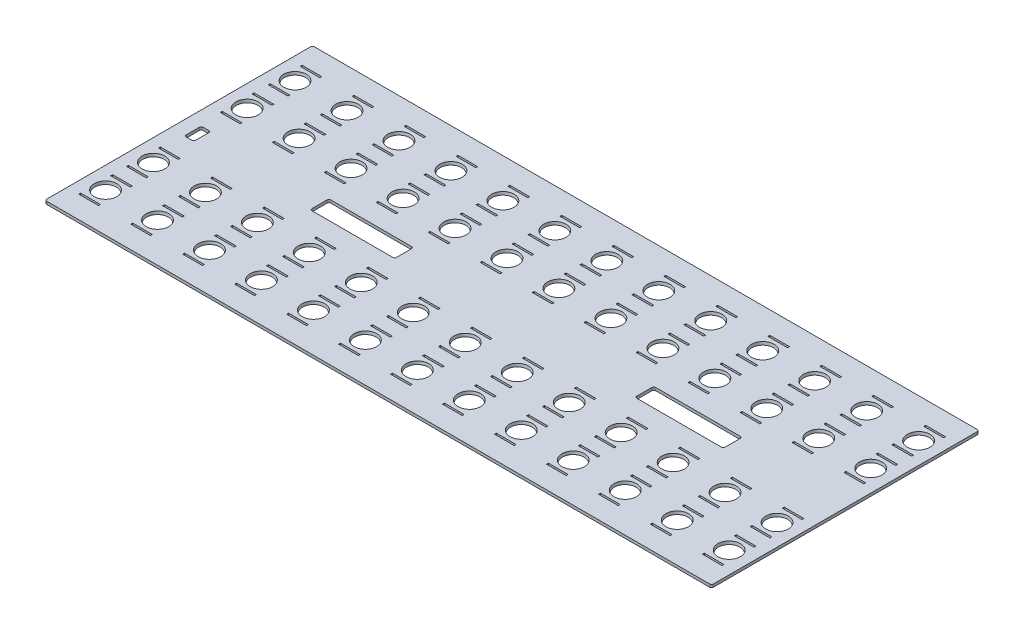
from build123d import *

# Parameters (mm, degrees)
BOSS_EXTRUDE1_DEPTH      = 3
CUT_EXTRUDE1_DEPTH       = 725.165209051
LPATTERN1_COUNT          = 13
LPATTERN1_PITCH          = 55.35
LPATTERN1_COUNT_DIR2     = 2
LPATTERN1_PITCH_DIR2     = 51
SKETCH7_W                = 21
SKETCH7_H                = 2
CUT_EXTRUDE2_DEPTH       = 725.165209051
LPATTERN2_COUNT          = 13
LPATTERN2_PITCH          = 55.35
LPATTERN2_COUNT_DIR2     = 2
LPATTERN2_PITCH_DIR2     = 51
MIRROR2_COPY_1_SKETCH_W  = 21
MIRROR2_COPY_1_SKETCH_H  = 2
MIRROR2_COPY_1_DEPTH     = 725.165209051
MIRROR2_COPY_2_SKETCH_W  = 21
MIRROR2_COPY_2_SKETCH_H  = 2
MIRROR2_COPY_2_DEPTH     = 725.165209051
MIRROR2_COPY_3_SKETCH_W  = 21
MIRROR2_COPY_3_SKETCH_H  = 2
MIRROR2_COPY_3_DEPTH     = 725.165209051
MIRROR2_COPY_4_SKETCH_W  = 21
MIRROR2_COPY_4_SKETCH_H  = 2
MIRROR2_COPY_4_DEPTH     = 725.165209051
MIRROR2_COPY_5_SKETCH_W  = 21
MIRROR2_COPY_5_SKETCH_H  = 2
MIRROR2_COPY_5_DEPTH     = 725.165209051
MIRROR2_COPY_6_SKETCH_W  = 21
MIRROR2_COPY_6_SKETCH_H  = 2
MIRROR2_COPY_6_DEPTH     = 725.165209051
MIRROR2_COPY_7_SKETCH_W  = 21
MIRROR2_COPY_7_SKETCH_H  = 2
MIRROR2_COPY_7_DEPTH     = 725.165209051
MIRROR2_COPY_8_SKETCH_W  = 21
MIRROR2_COPY_8_SKETCH_H  = 2
MIRROR2_COPY_8_DEPTH     = 725.165209051
MIRROR2_COPY_9_SKETCH_W  = 21
MIRROR2_COPY_9_SKETCH_H  = 2
MIRROR2_COPY_9_DEPTH     = 725.165209051
MIRROR2_COPY_10_SKETCH_W = 21
MIRROR2_COPY_10_SKETCH_H = 2
MIRROR2_COPY_10_DEPTH    = 725.165209051
MIRROR2_COPY_11_SKETCH_W = 21
MIRROR2_COPY_11_SKETCH_H = 2
MIRROR2_COPY_11_DEPTH    = 725.165209051
MIRROR2_COPY_12_SKETCH_W = 21
MIRROR2_COPY_12_SKETCH_H = 2
MIRROR2_COPY_12_DEPTH    = 725.165209051
MIRROR2_COPY_13_SKETCH_W = 21
MIRROR2_COPY_13_SKETCH_H = 2
MIRROR2_COPY_13_DEPTH    = 725.165209051
MIRROR2_COPY_14_SKETCH_W = 21
MIRROR2_COPY_14_SKETCH_H = 2
MIRROR2_COPY_14_DEPTH    = 725.165209051
MIRROR2_COPY_15_SKETCH_W = 21
MIRROR2_COPY_15_SKETCH_H = 2
MIRROR2_COPY_15_DEPTH    = 725.165209051
MIRROR2_COPY_16_SKETCH_W = 21
MIRROR2_COPY_16_SKETCH_H = 2
MIRROR2_COPY_16_DEPTH    = 725.165209051
MIRROR2_COPY_17_SKETCH_W = 21
MIRROR2_COPY_17_SKETCH_H = 2
MIRROR2_COPY_17_DEPTH    = 725.165209051
MIRROR2_COPY_18_SKETCH_W = 21
MIRROR2_COPY_18_SKETCH_H = 2
MIRROR2_COPY_18_DEPTH    = 725.165209051
MIRROR2_COPY_19_SKETCH_W = 21
MIRROR2_COPY_19_SKETCH_H = 2
MIRROR2_COPY_19_DEPTH    = 725.165209051
MIRROR2_COPY_20_SKETCH_W = 21
MIRROR2_COPY_20_SKETCH_H = 2
MIRROR2_COPY_20_DEPTH    = 725.165209051
MIRROR2_COPY_21_SKETCH_W = 21
MIRROR2_COPY_21_SKETCH_H = 2
MIRROR2_COPY_21_DEPTH    = 725.165209051
MIRROR2_COPY_22_SKETCH_W = 21
MIRROR2_COPY_22_SKETCH_H = 2
MIRROR2_COPY_22_DEPTH    = 725.165209051
MIRROR2_COPY_23_SKETCH_W = 21
MIRROR2_COPY_23_SKETCH_H = 2
MIRROR2_COPY_23_DEPTH    = 725.165209051
MIRROR2_COPY_24_SKETCH_W = 21
MIRROR2_COPY_24_SKETCH_H = 2
MIRROR2_COPY_24_DEPTH    = 725.165209051
MIRROR2_COPY_25_SKETCH_W = 21
MIRROR2_COPY_25_SKETCH_H = 2
MIRROR2_COPY_25_DEPTH    = 725.165209051


# Read off the part's stored shape, not the designer's step: Boundary-Cut4
with BuildPart() as part:
    # Sketch1 → Boss-Extrude1 (new body)
    with BuildSketch(Plane(origin=(0, 0, 0), x_dir=(1, 0, 0), z_dir=(0, 1, 0))):
        with BuildLine():
            Line((708, 142.5), (2, 142.5))
            ThreePointArc((2, 142.5), (0.585786438, 141.914213562), (0, 140.5))
            Line((0, 140.5), (0, -140.5))
            ThreePointArc((0, -140.5), (0.585786438, -141.914213562), (2, -142.5))
            Line((2, -142.5), (708, -142.5))
            ThreePointArc((708, -142.5), (709.414213562, -141.914213562), (710, -140.5))
            Line((710, -140.5), (710, 140.5))
            ThreePointArc((710, 140.5), (709.414213562, 141.914213562), (708, 142.5))
        make_face()
    extrude(amount=BOSS_EXTRUDE1_DEPTH)

    # Sketch2 → Cut-Extrude1 (cut, through all)
    with BuildSketch(Plane(origin=(0, 0, 0), x_dir=(1, 0, 0), z_dir=(0, 1, 0))):
        with BuildLine():
            Line((152, 10), (238, 10))
            ThreePointArc((238, 10), (239.414213562, 9.414213562), (240, 8))
            Line((240, 8), (240, -8))
            ThreePointArc((240, -8), (239.414213562, -9.414213562), (238, -10))
            Line((238, -10), (152, -10))
            ThreePointArc((152, -10), (150.585786438, -9.414213562), (150, -8))
            Line((150, -8), (150, 8))
            ThreePointArc((150, 8), (150.585786438, 9.414213562), (152, 10))
        make_face()
        with BuildLine():
            Line((498, 10), (588, 10))
            ThreePointArc((588, 10), (589.414213562, 9.414213562), (590, 8))
            Line((590, 8), (590, -8))
            ThreePointArc((590, -8), (589.414213562, -9.414213562), (588, -10))
            Line((588, -10), (498, -10))
            ThreePointArc((498, -10), (496.585786438, -9.414213562), (496, -8))
            Line((496, -8), (496, 8))
            ThreePointArc((496, 8), (496.585786438, 9.414213562), (498, 10))
        make_face()
        with BuildLine():
            Line((17, 9), (23, 9))
            ThreePointArc((23, 9), (24.414213562, 8.414213562), (25, 7))
            Line((25, 7), (25, -7))
            ThreePointArc((25, -7), (24.414213562, -8.414213562), (23, -9))
            Line((23, -9), (17, -9))
            ThreePointArc((17, -9), (15.585786438, -8.414213562), (15, -7))
            Line((15, -7), (15, 7))
            ThreePointArc((15, 7), (15.585786438, 8.414213562), (17, 9))
        make_face()
    extrude(amount=CUT_EXTRUDE1_DEPTH, mode=Mode.SUBTRACT)

    # Boundary-Cut4 outline → Boundary-Cut4 (revolve, cut)
    with BuildSketch(Plane(origin=(23, 0, -100.9), x_dir=(1, 0, 0), z_dir=(0, 0, 1))):
        Polygon((12, 3), (0, 3), (0, 0), (11.5, 0), align=None)
    boundary_cut4 = revolve(axis=Axis((23, 0, -100.9), (0, 1, 0)), mode=Mode.SUBTRACT)

    # LPattern1: Boundary-Cut4 13 × 2
    with Locations(*[(i * LPATTERN1_PITCH, 0, j * LPATTERN1_PITCH_DIR2) for i in range(LPATTERN1_COUNT) for j in range(LPATTERN1_COUNT_DIR2) if (i, j) != (0, 0)]):
        add(boundary_cut4, mode=Mode.SUBTRACT)

    # Mirror1: Boundary-Cut4 across plane
    add(boundary_cut4.mirror(Plane.XY), mode=Mode.SUBTRACT)

    # Mirror1 copy 1 sketch → Mirror1 copy 1 (revolve, cut)
    with BuildSketch(Plane(origin=(23, 0, 49.9), x_dir=(1, 0, 0), z_dir=(0, 0, -1))):
        Polygon((12, -3), (0, -3), (0, 0), (11.5, 0), align=None)
    revolve(axis=Axis((23, 0, 49.9), (0, -1, 0)), mode=Mode.SUBTRACT)

    # Mirror1 copy 2 sketch → Mirror1 copy 2 (revolve, cut)
    with BuildSketch(Plane(origin=(78.35, 0, 100.9), x_dir=(1, 0, 0), z_dir=(0, 0, -1))):
        Polygon((12, -3), (0, -3), (0, 0), (11.5, 0), align=None)
    revolve(axis=Axis((78.35, 0, 100.9), (0, -1, 0)), mode=Mode.SUBTRACT)

    # Mirror1 copy 3 sketch → Mirror1 copy 3 (revolve, cut)
    with BuildSketch(Plane(origin=(78.35, 0, 49.9), x_dir=(1, 0, 0), z_dir=(0, 0, -1))):
        Polygon((12, -3), (0, -3), (0, 0), (11.5, 0), align=None)
    revolve(axis=Axis((78.35, 0, 49.9), (0, -1, 0)), mode=Mode.SUBTRACT)

    # Mirror1 copy 4 sketch → Mirror1 copy 4 (revolve, cut)
    with BuildSketch(Plane(origin=(133.7, 0, 100.9), x_dir=(1, 0, 0), z_dir=(0, 0, -1))):
        Polygon((12, -3), (0, -3), (0, 0), (11.5, 0), align=None)
    revolve(axis=Axis((133.7, 0, 100.9), (0, -1, 0)), mode=Mode.SUBTRACT)

    # Mirror1 copy 5 sketch → Mirror1 copy 5 (revolve, cut)
    with BuildSketch(Plane(origin=(133.7, 0, 49.9), x_dir=(1, 0, 0), z_dir=(0, 0, -1))):
        Polygon((12, -3), (0, -3), (0, 0), (11.5, 0), align=None)
    revolve(axis=Axis((133.7, 0, 49.9), (0, -1, 0)), mode=Mode.SUBTRACT)

    # Mirror1 copy 6 sketch → Mirror1 copy 6 (revolve, cut)
    with BuildSketch(Plane(origin=(189.05, 0, 100.9), x_dir=(1, 0, 0), z_dir=(0, 0, -1))):
        Polygon((12, -3), (0, -3), (0, 0), (11.5, 0), align=None)
    revolve(axis=Axis((189.05, 0, 100.9), (0, -1, 0)), mode=Mode.SUBTRACT)

    # Mirror1 copy 7 sketch → Mirror1 copy 7 (revolve, cut)
    with BuildSketch(Plane(origin=(189.05, 0, 49.9), x_dir=(1, 0, 0), z_dir=(0, 0, -1))):
        Polygon((12, -3), (0, -3), (0, 0), (11.5, 0), align=None)
    revolve(axis=Axis((189.05, 0, 49.9), (0, -1, 0)), mode=Mode.SUBTRACT)

    # Mirror1 copy 8 sketch → Mirror1 copy 8 (revolve, cut)
    with BuildSketch(Plane(origin=(244.4, 0, 100.9), x_dir=(1, 0, 0), z_dir=(0, 0, -1))):
        Polygon((12, -3), (0, -3), (0, 0), (11.5, 0), align=None)
    revolve(axis=Axis((244.4, 0, 100.9), (0, -1, 0)), mode=Mode.SUBTRACT)

    # Mirror1 copy 9 sketch → Mirror1 copy 9 (revolve, cut)
    with BuildSketch(Plane(origin=(244.4, 0, 49.9), x_dir=(1, 0, 0), z_dir=(0, 0, -1))):
        Polygon((12, -3), (0, -3), (0, 0), (11.5, 0), align=None)
    revolve(axis=Axis((244.4, 0, 49.9), (0, -1, 0)), mode=Mode.SUBTRACT)

    # Mirror1 copy 10 sketch → Mirror1 copy 10 (revolve, cut)
    with BuildSketch(Plane(origin=(299.75, 0, 100.9), x_dir=(1, 0, 0), z_dir=(0, 0, -1))):
        Polygon((12, -3), (0, -3), (0, 0), (11.5, 0), align=None)
    revolve(axis=Axis((299.75, 0, 100.9), (0, -1, 0)), mode=Mode.SUBTRACT)

    # Mirror1 copy 11 sketch → Mirror1 copy 11 (revolve, cut)
    with BuildSketch(Plane(origin=(299.75, 0, 49.9), x_dir=(1, 0, 0), z_dir=(0, 0, -1))):
        Polygon((12, -3), (0, -3), (0, 0), (11.5, 0), align=None)
    revolve(axis=Axis((299.75, 0, 49.9), (0, -1, 0)), mode=Mode.SUBTRACT)

    # Mirror1 copy 12 sketch → Mirror1 copy 12 (revolve, cut)
    with BuildSketch(Plane(origin=(355.1, 0, 100.9), x_dir=(1, 0, 0), z_dir=(0, 0, -1))):
        Polygon((12, -3), (0, -3), (0, 0), (11.5, 0), align=None)
    revolve(axis=Axis((355.1, 0, 100.9), (0, -1, 0)), mode=Mode.SUBTRACT)

    # Mirror1 copy 13 sketch → Mirror1 copy 13 (revolve, cut)
    with BuildSketch(Plane(origin=(355.1, 0, 49.9), x_dir=(1, 0, 0), z_dir=(0, 0, -1))):
        Polygon((12, -3), (0, -3), (0, 0), (11.5, 0), align=None)
    revolve(axis=Axis((355.1, 0, 49.9), (0, -1, 0)), mode=Mode.SUBTRACT)

    # Mirror1 copy 14 sketch → Mirror1 copy 14 (revolve, cut)
    with BuildSketch(Plane(origin=(410.45, 0, 100.9), x_dir=(1, 0, 0), z_dir=(0, 0, -1))):
        Polygon((12, -3), (0, -3), (0, 0), (11.5, 0), align=None)
    revolve(axis=Axis((410.45, 0, 100.9), (0, -1, 0)), mode=Mode.SUBTRACT)

    # Mirror1 copy 15 sketch → Mirror1 copy 15 (revolve, cut)
    with BuildSketch(Plane(origin=(410.45, 0, 49.9), x_dir=(1, 0, 0), z_dir=(0, 0, -1))):
        Polygon((12, -3), (0, -3), (0, 0), (11.5, 0), align=None)
    revolve(axis=Axis((410.45, 0, 49.9), (0, -1, 0)), mode=Mode.SUBTRACT)

    # Mirror1 copy 16 sketch → Mirror1 copy 16 (revolve, cut)
    with BuildSketch(Plane(origin=(465.8, 0, 100.9), x_dir=(1, 0, 0), z_dir=(0, 0, -1))):
        Polygon((12, -3), (0, -3), (0, 0), (11.5, 0), align=None)
    revolve(axis=Axis((465.8, 0, 100.9), (0, -1, 0)), mode=Mode.SUBTRACT)

    # Mirror1 copy 17 sketch → Mirror1 copy 17 (revolve, cut)
    with BuildSketch(Plane(origin=(465.8, 0, 49.9), x_dir=(1, 0, 0), z_dir=(0, 0, -1))):
        Polygon((12, -3), (0, -3), (0, 0), (11.5, 0), align=None)
    revolve(axis=Axis((465.8, 0, 49.9), (0, -1, 0)), mode=Mode.SUBTRACT)

    # Mirror1 copy 18 sketch → Mirror1 copy 18 (revolve, cut)
    with BuildSketch(Plane(origin=(521.15, 0, 100.9), x_dir=(1, 0, 0), z_dir=(0, 0, -1))):
        Polygon((12, -3), (0, -3), (0, 0), (11.5, 0), align=None)
    revolve(axis=Axis((521.15, 0, 100.9), (0, -1, 0)), mode=Mode.SUBTRACT)

    # Mirror1 copy 19 sketch → Mirror1 copy 19 (revolve, cut)
    with BuildSketch(Plane(origin=(521.15, 0, 49.9), x_dir=(1, 0, 0), z_dir=(0, 0, -1))):
        Polygon((12, -3), (0, -3), (0, 0), (11.5, 0), align=None)
    revolve(axis=Axis((521.15, 0, 49.9), (0, -1, 0)), mode=Mode.SUBTRACT)

    # Mirror1 copy 20 sketch → Mirror1 copy 20 (revolve, cut)
    with BuildSketch(Plane(origin=(576.5, 0, 100.9), x_dir=(1, 0, 0), z_dir=(0, 0, -1))):
        Polygon((12, -3), (0, -3), (0, 0), (11.5, 0), align=None)
    revolve(axis=Axis((576.5, 0, 100.9), (0, -1, 0)), mode=Mode.SUBTRACT)

    # Mirror1 copy 21 sketch → Mirror1 copy 21 (revolve, cut)
    with BuildSketch(Plane(origin=(576.5, 0, 49.9), x_dir=(1, 0, 0), z_dir=(0, 0, -1))):
        Polygon((12, -3), (0, -3), (0, 0), (11.5, 0), align=None)
    revolve(axis=Axis((576.5, 0, 49.9), (0, -1, 0)), mode=Mode.SUBTRACT)

    # Mirror1 copy 22 sketch → Mirror1 copy 22 (revolve, cut)
    with BuildSketch(Plane(origin=(631.85, 0, 100.9), x_dir=(1, 0, 0), z_dir=(0, 0, -1))):
        Polygon((12, -3), (0, -3), (0, 0), (11.5, 0), align=None)
    revolve(axis=Axis((631.85, 0, 100.9), (0, -1, 0)), mode=Mode.SUBTRACT)

    # Mirror1 copy 23 sketch → Mirror1 copy 23 (revolve, cut)
    with BuildSketch(Plane(origin=(631.85, 0, 49.9), x_dir=(1, 0, 0), z_dir=(0, 0, -1))):
        Polygon((12, -3), (0, -3), (0, 0), (11.5, 0), align=None)
    revolve(axis=Axis((631.85, 0, 49.9), (0, -1, 0)), mode=Mode.SUBTRACT)

    # Mirror1 copy 24 sketch → Mirror1 copy 24 (revolve, cut)
    with BuildSketch(Plane(origin=(687.2, 0, 100.9), x_dir=(1, 0, 0), z_dir=(0, 0, -1))):
        Polygon((12, -3), (0, -3), (0, 0), (11.5, 0), align=None)
    revolve(axis=Axis((687.2, 0, 100.9), (0, -1, 0)), mode=Mode.SUBTRACT)

    # Mirror1 copy 25 sketch → Mirror1 copy 25 (revolve, cut)
    with BuildSketch(Plane(origin=(687.2, 0, 49.9), x_dir=(1, 0, 0), z_dir=(0, 0, -1))):
        Polygon((12, -3), (0, -3), (0, 0), (11.5, 0), align=None)
    revolve(axis=Axis((687.2, 0, 49.9), (0, -1, 0)), mode=Mode.SUBTRACT)

    # Sketch7 → Cut-Extrude2 (cut, through all)
    with BuildSketch(Plane(origin=(0, 3, 0), x_dir=(1, 0, 0), z_dir=(0, 1, 0))):
        with Locations((23, 117.9)):
            Rectangle(SKETCH7_W, SKETCH7_H)
        with Locations((23, 83.9)):
            Rectangle(SKETCH7_W, SKETCH7_H)
    cut_extrude2 = extrude(amount=-CUT_EXTRUDE2_DEPTH, mode=Mode.SUBTRACT)

    # LPattern2: Cut-Extrude2 13 × 2
    with Locations(*[(i * LPATTERN2_PITCH, 0, j * LPATTERN2_PITCH_DIR2) for i in range(LPATTERN2_COUNT) for j in range(LPATTERN2_COUNT_DIR2) if (i, j) != (0, 0)]):
        add(cut_extrude2, mode=Mode.SUBTRACT)

    # Mirror2: Cut-Extrude2 across plane
    add(cut_extrude2.mirror(Plane.XY), mode=Mode.SUBTRACT)

    # Mirror2 copy 1 sketch → Mirror2 copy 1 (cut, through all)
    with BuildSketch(Plane(origin=(0, 3, -51), x_dir=(1, 0, 0), z_dir=(0, 1, 0))):
        with Locations((23, -117.9)):
            Rectangle(MIRROR2_COPY_1_SKETCH_W, MIRROR2_COPY_1_SKETCH_H)
        with Locations((23, -83.9)):
            Rectangle(MIRROR2_COPY_1_SKETCH_W, MIRROR2_COPY_1_SKETCH_H)
    extrude(amount=-MIRROR2_COPY_1_DEPTH, mode=Mode.SUBTRACT)

    # Mirror2 copy 2 sketch → Mirror2 copy 2 (cut, through all)
    with BuildSketch(Plane(origin=(55.35, 3, 0), x_dir=(1, 0, 0), z_dir=(0, 1, 0))):
        with Locations((23, -117.9)):
            Rectangle(MIRROR2_COPY_2_SKETCH_W, MIRROR2_COPY_2_SKETCH_H)
        with Locations((23, -83.9)):
            Rectangle(MIRROR2_COPY_2_SKETCH_W, MIRROR2_COPY_2_SKETCH_H)
    extrude(amount=-MIRROR2_COPY_2_DEPTH, mode=Mode.SUBTRACT)

    # Mirror2 copy 3 sketch → Mirror2 copy 3 (cut, through all)
    with BuildSketch(Plane(origin=(55.35, 3, -51), x_dir=(1, 0, 0), z_dir=(0, 1, 0))):
        with Locations((23, -117.9)):
            Rectangle(MIRROR2_COPY_3_SKETCH_W, MIRROR2_COPY_3_SKETCH_H)
        with Locations((23, -83.9)):
            Rectangle(MIRROR2_COPY_3_SKETCH_W, MIRROR2_COPY_3_SKETCH_H)
    extrude(amount=-MIRROR2_COPY_3_DEPTH, mode=Mode.SUBTRACT)

    # Mirror2 copy 4 sketch → Mirror2 copy 4 (cut, through all)
    with BuildSketch(Plane(origin=(110.7, 3, 0), x_dir=(1, 0, 0), z_dir=(0, 1, 0))):
        with Locations((23, -117.9)):
            Rectangle(MIRROR2_COPY_4_SKETCH_W, MIRROR2_COPY_4_SKETCH_H)
        with Locations((23, -83.9)):
            Rectangle(MIRROR2_COPY_4_SKETCH_W, MIRROR2_COPY_4_SKETCH_H)
    extrude(amount=-MIRROR2_COPY_4_DEPTH, mode=Mode.SUBTRACT)

    # Mirror2 copy 5 sketch → Mirror2 copy 5 (cut, through all)
    with BuildSketch(Plane(origin=(110.7, 3, -51), x_dir=(1, 0, 0), z_dir=(0, 1, 0))):
        with Locations((23, -117.9)):
            Rectangle(MIRROR2_COPY_5_SKETCH_W, MIRROR2_COPY_5_SKETCH_H)
        with Locations((23, -83.9)):
            Rectangle(MIRROR2_COPY_5_SKETCH_W, MIRROR2_COPY_5_SKETCH_H)
    extrude(amount=-MIRROR2_COPY_5_DEPTH, mode=Mode.SUBTRACT)

    # Mirror2 copy 6 sketch → Mirror2 copy 6 (cut, through all)
    with BuildSketch(Plane(origin=(166.05, 3, 0), x_dir=(1, 0, 0), z_dir=(0, 1, 0))):
        with Locations((23, -117.9)):
            Rectangle(MIRROR2_COPY_6_SKETCH_W, MIRROR2_COPY_6_SKETCH_H)
        with Locations((23, -83.9)):
            Rectangle(MIRROR2_COPY_6_SKETCH_W, MIRROR2_COPY_6_SKETCH_H)
    extrude(amount=-MIRROR2_COPY_6_DEPTH, mode=Mode.SUBTRACT)

    # Mirror2 copy 7 sketch → Mirror2 copy 7 (cut, through all)
    with BuildSketch(Plane(origin=(166.05, 3, -51), x_dir=(1, 0, 0), z_dir=(0, 1, 0))):
        with Locations((23, -117.9)):
            Rectangle(MIRROR2_COPY_7_SKETCH_W, MIRROR2_COPY_7_SKETCH_H)
        with Locations((23, -83.9)):
            Rectangle(MIRROR2_COPY_7_SKETCH_W, MIRROR2_COPY_7_SKETCH_H)
    extrude(amount=-MIRROR2_COPY_7_DEPTH, mode=Mode.SUBTRACT)

    # Mirror2 copy 8 sketch → Mirror2 copy 8 (cut, through all)
    with BuildSketch(Plane(origin=(221.4, 3, 0), x_dir=(1, 0, 0), z_dir=(0, 1, 0))):
        with Locations((23, -117.9)):
            Rectangle(MIRROR2_COPY_8_SKETCH_W, MIRROR2_COPY_8_SKETCH_H)
        with Locations((23, -83.9)):
            Rectangle(MIRROR2_COPY_8_SKETCH_W, MIRROR2_COPY_8_SKETCH_H)
    extrude(amount=-MIRROR2_COPY_8_DEPTH, mode=Mode.SUBTRACT)

    # Mirror2 copy 9 sketch → Mirror2 copy 9 (cut, through all)
    with BuildSketch(Plane(origin=(221.4, 3, -51), x_dir=(1, 0, 0), z_dir=(0, 1, 0))):
        with Locations((23, -117.9)):
            Rectangle(MIRROR2_COPY_9_SKETCH_W, MIRROR2_COPY_9_SKETCH_H)
        with Locations((23, -83.9)):
            Rectangle(MIRROR2_COPY_9_SKETCH_W, MIRROR2_COPY_9_SKETCH_H)
    extrude(amount=-MIRROR2_COPY_9_DEPTH, mode=Mode.SUBTRACT)

    # Mirror2 copy 10 sketch → Mirror2 copy 10 (cut, through all)
    with BuildSketch(Plane(origin=(276.75, 3, 0), x_dir=(1, 0, 0), z_dir=(0, 1, 0))):
        with Locations((23, -117.9)):
            Rectangle(MIRROR2_COPY_10_SKETCH_W, MIRROR2_COPY_10_SKETCH_H)
        with Locations((23, -83.9)):
            Rectangle(MIRROR2_COPY_10_SKETCH_W, MIRROR2_COPY_10_SKETCH_H)
    extrude(amount=-MIRROR2_COPY_10_DEPTH, mode=Mode.SUBTRACT)

    # Mirror2 copy 11 sketch → Mirror2 copy 11 (cut, through all)
    with BuildSketch(Plane(origin=(276.75, 3, -51), x_dir=(1, 0, 0), z_dir=(0, 1, 0))):
        with Locations((23, -117.9)):
            Rectangle(MIRROR2_COPY_11_SKETCH_W, MIRROR2_COPY_11_SKETCH_H)
        with Locations((23, -83.9)):
            Rectangle(MIRROR2_COPY_11_SKETCH_W, MIRROR2_COPY_11_SKETCH_H)
    extrude(amount=-MIRROR2_COPY_11_DEPTH, mode=Mode.SUBTRACT)

    # Mirror2 copy 12 sketch → Mirror2 copy 12 (cut, through all)
    with BuildSketch(Plane(origin=(332.1, 3, 0), x_dir=(1, 0, 0), z_dir=(0, 1, 0))):
        with Locations((23, -117.9)):
            Rectangle(MIRROR2_COPY_12_SKETCH_W, MIRROR2_COPY_12_SKETCH_H)
        with Locations((23, -83.9)):
            Rectangle(MIRROR2_COPY_12_SKETCH_W, MIRROR2_COPY_12_SKETCH_H)
    extrude(amount=-MIRROR2_COPY_12_DEPTH, mode=Mode.SUBTRACT)

    # Mirror2 copy 13 sketch → Mirror2 copy 13 (cut, through all)
    with BuildSketch(Plane(origin=(332.1, 3, -51), x_dir=(1, 0, 0), z_dir=(0, 1, 0))):
        with Locations((23, -117.9)):
            Rectangle(MIRROR2_COPY_13_SKETCH_W, MIRROR2_COPY_13_SKETCH_H)
        with Locations((23, -83.9)):
            Rectangle(MIRROR2_COPY_13_SKETCH_W, MIRROR2_COPY_13_SKETCH_H)
    extrude(amount=-MIRROR2_COPY_13_DEPTH, mode=Mode.SUBTRACT)

    # Mirror2 copy 14 sketch → Mirror2 copy 14 (cut, through all)
    with BuildSketch(Plane(origin=(387.45, 3, 0), x_dir=(1, 0, 0), z_dir=(0, 1, 0))):
        with Locations((23, -117.9)):
            Rectangle(MIRROR2_COPY_14_SKETCH_W, MIRROR2_COPY_14_SKETCH_H)
        with Locations((23, -83.9)):
            Rectangle(MIRROR2_COPY_14_SKETCH_W, MIRROR2_COPY_14_SKETCH_H)
    extrude(amount=-MIRROR2_COPY_14_DEPTH, mode=Mode.SUBTRACT)

    # Mirror2 copy 15 sketch → Mirror2 copy 15 (cut, through all)
    with BuildSketch(Plane(origin=(387.45, 3, -51), x_dir=(1, 0, 0), z_dir=(0, 1, 0))):
        with Locations((23, -117.9)):
            Rectangle(MIRROR2_COPY_15_SKETCH_W, MIRROR2_COPY_15_SKETCH_H)
        with Locations((23, -83.9)):
            Rectangle(MIRROR2_COPY_15_SKETCH_W, MIRROR2_COPY_15_SKETCH_H)
    extrude(amount=-MIRROR2_COPY_15_DEPTH, mode=Mode.SUBTRACT)

    # Mirror2 copy 16 sketch → Mirror2 copy 16 (cut, through all)
    with BuildSketch(Plane(origin=(442.8, 3, 0), x_dir=(1, 0, 0), z_dir=(0, 1, 0))):
        with Locations((23, -117.9)):
            Rectangle(MIRROR2_COPY_16_SKETCH_W, MIRROR2_COPY_16_SKETCH_H)
        with Locations((23, -83.9)):
            Rectangle(MIRROR2_COPY_16_SKETCH_W, MIRROR2_COPY_16_SKETCH_H)
    extrude(amount=-MIRROR2_COPY_16_DEPTH, mode=Mode.SUBTRACT)

    # Mirror2 copy 17 sketch → Mirror2 copy 17 (cut, through all)
    with BuildSketch(Plane(origin=(442.8, 3, -51), x_dir=(1, 0, 0), z_dir=(0, 1, 0))):
        with Locations((23, -117.9)):
            Rectangle(MIRROR2_COPY_17_SKETCH_W, MIRROR2_COPY_17_SKETCH_H)
        with Locations((23, -83.9)):
            Rectangle(MIRROR2_COPY_17_SKETCH_W, MIRROR2_COPY_17_SKETCH_H)
    extrude(amount=-MIRROR2_COPY_17_DEPTH, mode=Mode.SUBTRACT)

    # Mirror2 copy 18 sketch → Mirror2 copy 18 (cut, through all)
    with BuildSketch(Plane(origin=(498.15, 3, 0), x_dir=(1, 0, 0), z_dir=(0, 1, 0))):
        with Locations((23, -117.9)):
            Rectangle(MIRROR2_COPY_18_SKETCH_W, MIRROR2_COPY_18_SKETCH_H)
        with Locations((23, -83.9)):
            Rectangle(MIRROR2_COPY_18_SKETCH_W, MIRROR2_COPY_18_SKETCH_H)
    extrude(amount=-MIRROR2_COPY_18_DEPTH, mode=Mode.SUBTRACT)

    # Mirror2 copy 19 sketch → Mirror2 copy 19 (cut, through all)
    with BuildSketch(Plane(origin=(498.15, 3, -51), x_dir=(1, 0, 0), z_dir=(0, 1, 0))):
        with Locations((23, -117.9)):
            Rectangle(MIRROR2_COPY_19_SKETCH_W, MIRROR2_COPY_19_SKETCH_H)
        with Locations((23, -83.9)):
            Rectangle(MIRROR2_COPY_19_SKETCH_W, MIRROR2_COPY_19_SKETCH_H)
    extrude(amount=-MIRROR2_COPY_19_DEPTH, mode=Mode.SUBTRACT)

    # Mirror2 copy 20 sketch → Mirror2 copy 20 (cut, through all)
    with BuildSketch(Plane(origin=(553.5, 3, 0), x_dir=(1, 0, 0), z_dir=(0, 1, 0))):
        with Locations((23, -117.9)):
            Rectangle(MIRROR2_COPY_20_SKETCH_W, MIRROR2_COPY_20_SKETCH_H)
        with Locations((23, -83.9)):
            Rectangle(MIRROR2_COPY_20_SKETCH_W, MIRROR2_COPY_20_SKETCH_H)
    extrude(amount=-MIRROR2_COPY_20_DEPTH, mode=Mode.SUBTRACT)

    # Mirror2 copy 21 sketch → Mirror2 copy 21 (cut, through all)
    with BuildSketch(Plane(origin=(553.5, 3, -51), x_dir=(1, 0, 0), z_dir=(0, 1, 0))):
        with Locations((23, -117.9)):
            Rectangle(MIRROR2_COPY_21_SKETCH_W, MIRROR2_COPY_21_SKETCH_H)
        with Locations((23, -83.9)):
            Rectangle(MIRROR2_COPY_21_SKETCH_W, MIRROR2_COPY_21_SKETCH_H)
    extrude(amount=-MIRROR2_COPY_21_DEPTH, mode=Mode.SUBTRACT)

    # Mirror2 copy 22 sketch → Mirror2 copy 22 (cut, through all)
    with BuildSketch(Plane(origin=(608.85, 3, 0), x_dir=(1, 0, 0), z_dir=(0, 1, 0))):
        with Locations((23, -117.9)):
            Rectangle(MIRROR2_COPY_22_SKETCH_W, MIRROR2_COPY_22_SKETCH_H)
        with Locations((23, -83.9)):
            Rectangle(MIRROR2_COPY_22_SKETCH_W, MIRROR2_COPY_22_SKETCH_H)
    extrude(amount=-MIRROR2_COPY_22_DEPTH, mode=Mode.SUBTRACT)

    # Mirror2 copy 23 sketch → Mirror2 copy 23 (cut, through all)
    with BuildSketch(Plane(origin=(608.85, 3, -51), x_dir=(1, 0, 0), z_dir=(0, 1, 0))):
        with Locations((23, -117.9)):
            Rectangle(MIRROR2_COPY_23_SKETCH_W, MIRROR2_COPY_23_SKETCH_H)
        with Locations((23, -83.9)):
            Rectangle(MIRROR2_COPY_23_SKETCH_W, MIRROR2_COPY_23_SKETCH_H)
    extrude(amount=-MIRROR2_COPY_23_DEPTH, mode=Mode.SUBTRACT)

    # Mirror2 copy 24 sketch → Mirror2 copy 24 (cut, through all)
    with BuildSketch(Plane(origin=(664.2, 3, 0), x_dir=(1, 0, 0), z_dir=(0, 1, 0))):
        with Locations((23, -117.9)):
            Rectangle(MIRROR2_COPY_24_SKETCH_W, MIRROR2_COPY_24_SKETCH_H)
        with Locations((23, -83.9)):
            Rectangle(MIRROR2_COPY_24_SKETCH_W, MIRROR2_COPY_24_SKETCH_H)
    extrude(amount=-MIRROR2_COPY_24_DEPTH, mode=Mode.SUBTRACT)

    # Mirror2 copy 25 sketch → Mirror2 copy 25 (cut, through all)
    with BuildSketch(Plane(origin=(664.2, 3, -51), x_dir=(1, 0, 0), z_dir=(0, 1, 0))):
        with Locations((23, -117.9)):
            Rectangle(MIRROR2_COPY_25_SKETCH_W, MIRROR2_COPY_25_SKETCH_H)
        with Locations((23, -83.9)):
            Rectangle(MIRROR2_COPY_25_SKETCH_W, MIRROR2_COPY_25_SKETCH_H)
    extrude(amount=-MIRROR2_COPY_25_DEPTH, mode=Mode.SUBTRACT)


solid = part.part
